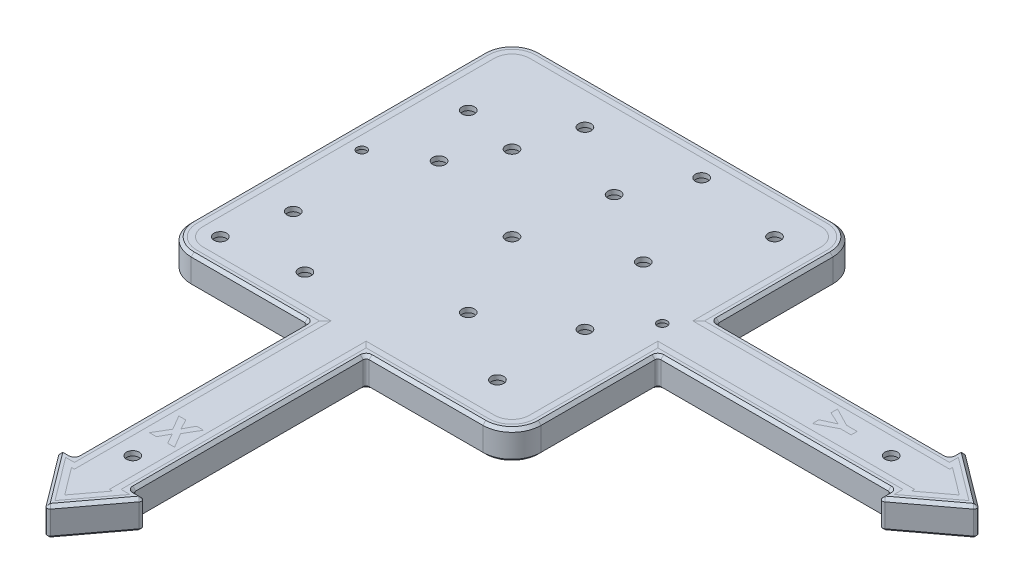
from build123d import *

# Parameters (mm, degrees)
BOSS_EXTRUDE1_DEPTH   = 10
SKETCH2_R             = 2.15
CUT_EXTRUDE1_DEPTH    = 199.242276016
SKETCH3_R             = 1.65
CUT_EXTRUDE2_DEPTH    = 199.242276016
SKETCH4_R             = 5
CUT_EXTRUDE3_DEPTH    = 8.4
SKETCH5_R             = 3
CUT_EXTRUDE4_DEPTH    = 9
FILLET1_R             = 10
BOSS_EXTRUDE2_DEPTH   = 10
CUT_EXTRUDE5_DEPTH    = 1
BOSS_EXTRUDE3_DEPTH   = 1
CUT_EXTRUDE6_DEPTH    = 1
BOSS_EXTRUDE4_DEPTH   = 1
CUT_EXTRUDE7_DEPTH    = 1
BOSS_EXTRUDE5_DEPTH   = 1
BOSS_EXTRUDE5_2_DEPTH = 1
FILLET2_R             = 1
CHAMFER1_SIZE         = 1
CUT_EXTRUDE8_DEPTH    = 1
BOSS_EXTRUDE6_DEPTH   = 1
CUT_EXTRUDE9_DEPTH    = 1
BOSS_EXTRUDE7_DEPTH   = 1


with BuildPart() as part:
    # Sketch1 → Boss-Extrude1 (new body)
    with BuildSketch(Plane(origin=(0, 0, 0), x_dir=(1, 0, 0), z_dir=(0, 1, 0))):
        Polygon((-10, -60), (-10, -140), (10, -140), (10, -60), (60, -60), (60, -10), (140, -10), (140, 10), (60, 10), (60, 60), (-60, 60), (-60, -60), align=None)
    extrude(amount=BOSS_EXTRUDE1_DEPTH)

    # Sketch2 → Cut-Extrude1 (cut, through all)
    with BuildSketch(Plane(origin=(0, 10, 0), x_dir=(1, 0, 0), z_dir=(0, 1, 0))):
        with Locations(Location((0, 0, 0), (0, 0, 270))):
            Circle(SKETCH2_R)
        with Locations(Location((130, 0, 0), (0, 0, 270))):
            Circle(SKETCH2_R)
        with Locations(Location((0, -130, 0), (0, 0, 270))):
            Circle(SKETCH2_R)
        with Locations(Location((40, -45, 0), (0, 0, 270))):
            Circle(SKETCH2_R)
        with Locations(Location((-45, -30, 0), (0, 0, 270))):
            Circle(SKETCH2_R)
        with Locations(Location((-26, 26, 0), (0, 0, 270))):
            Circle(SKETCH2_R)
        with Locations(Location((45, 45, 0), (0, 0, 270))):
            Circle(SKETCH2_R)
        with Locations(Location((15, 50, 0), (0, 0, 270))):
            Circle(SKETCH2_R)
        with Locations(Location((40, -15, 0), (0, 0, 270))):
            Circle(SKETCH2_R)
        with Locations(Location((-25, -46, 0), (0, 0, 270))):
            Circle(SKETCH2_R)
        with Locations(Location((-45, 30, 0), (0, 0, 270))):
            Circle(SKETCH2_R)
        with Locations(Location((-20, 45, 0), (0, 0, 270))):
            Circle(SKETCH2_R)
        with Locations(Location((15, -30, 0), (0, 0, 270))):
            Circle(SKETCH2_R)
        with Locations(Location((30, 15, 0), (0, 0, 270))):
            Circle(SKETCH2_R)
        with Locations(Location((-35, 10, 0), (0, 0, 270))):
            Circle(SKETCH2_R)
        with Locations(Location((5, 30, 0), (0, 0, 270))):
            Circle(SKETCH2_R)
        with Locations(Location((-50, -50, 0), (0, 0, 270))):
            Circle(SKETCH2_R)
    extrude(amount=-CUT_EXTRUDE1_DEPTH, mode=Mode.SUBTRACT)

    # Sketch3 → Cut-Extrude2 (cut, through all)
    with BuildSketch(Plane(origin=(0, 10, 0), x_dir=(1, 0, 0), z_dir=(0, 1, 0))):
        with Locations(Location((51.5, 0, 0), (0, 0, 270))):
            Circle(SKETCH3_R)
        with Locations(Location((-51.5, 0, 0), (0, 0, 270))):
            Circle(SKETCH3_R)
    extrude(amount=-CUT_EXTRUDE2_DEPTH, mode=Mode.SUBTRACT)

    # Sketch4 → Cut-Extrude3 (cut)
    with BuildSketch(Plane.XZ):
        with Locations(Location((-45, 30, 0), (0, 0, 270))):
            Circle(SKETCH4_R)
        with Locations(Location((40, 45, 0), (0, 0, 270))):
            Circle(SKETCH4_R)
        with Locations(Location((0, 130, 0), (0, 0, 270))):
            Circle(SKETCH4_R)
        with Locations(Location((130, 0, 0), (0, 0, 270))):
            Circle(SKETCH4_R)
        with Locations(Location((0, 0, 0), (0, 0, 270))):
            Circle(SKETCH4_R)
        with Locations(Location((-26, -26, 0), (0, 0, 270))):
            Circle(SKETCH4_R)
        with Locations(Location((45, -45, 0), (0, 0, 270))):
            Circle(SKETCH4_R)
        with Locations(Location((40, 15, 0), (0, 0, 270))):
            Circle(SKETCH4_R)
        with Locations(Location((-25, 46, 0), (0, 0, 270))):
            Circle(SKETCH4_R)
        with Locations(Location((-45, -30, 0), (0, 0, 270))):
            Circle(SKETCH4_R)
        with Locations(Location((15, -50, 0), (0, 0, 270))):
            Circle(SKETCH4_R)
        with Locations(Location((15, 30, 0), (0, 0, 270))):
            Circle(SKETCH4_R)
        with Locations(Location((30, -15, 0), (0, 0, 270))):
            Circle(SKETCH4_R)
        with Locations(Location((-20, -45, 0), (0, 0, 270))):
            Circle(SKETCH4_R)
        with Locations(Location((-35, -10, 0), (0, 0, 270))):
            Circle(SKETCH4_R)
        with Locations(Location((5, -30, 0), (0, 0, 270))):
            Circle(SKETCH4_R)
        with Locations(Location((-50, 50, 0), (0, 0, 270))):
            Circle(SKETCH4_R)
    extrude(amount=-CUT_EXTRUDE3_DEPTH, mode=Mode.SUBTRACT)

    # Sketch5 → Cut-Extrude4 (cut)
    with BuildSketch(Plane.XZ):
        with Locations(Location((-51.5, 0, 0), (0, 0, 270))):
            Circle(SKETCH5_R)
        with Locations(Location((51.5, 0, 0), (0, 0, 270))):
            Circle(SKETCH5_R)
    extrude(amount=-CUT_EXTRUDE4_DEPTH, mode=Mode.SUBTRACT)

    # Fillet1
    fillet1_edges = [part.edges().sort_by_distance(p)[0] for p in [
        (60, 5, 60),
        (-60, 5, 60),
        (-60, 5, -60),
        (60, 5, -60),
    ]]
    fillet(fillet1_edges, radius=FILLET1_R)

    # Sketch6 → Boss-Extrude2 (add)
    with BuildSketch(Plane(origin=(0, 10, 0), x_dir=(1, 0, 0), z_dir=(0, 1, 0))):
        Polygon((0, -140), (15, -140), (0, -160), (-15, -140), align=None)
        Polygon((140, 0), (140, -15), (160, 0), (140, 15), align=None)
    extrude(amount=-BOSS_EXTRUDE2_DEPTH)

    # Sketch7 → Cut-Extrude5 (cut)
    with BuildSketch(Plane(origin=(0, 10, 0), x_dir=(1, 0, 0), z_dir=(0, 1, 0))):
        Polygon((6, -144), (6, -56), (8, -58), (8, -142), (11, -142), (0, -156.666666667), (-11, -142), (-8, -142), (-8, -58), (-6, -56), (-6, -144), (-7, -144), (0, -153.333333333), (7, -144), align=None)
    extrude(amount=-CUT_EXTRUDE5_DEPTH, mode=Mode.SUBTRACT)

    # Sketch7<4> → Cut-Extrude6 (cut)
    with BuildSketch(Plane(origin=(0, 10, 0), x_dir=(1, 0, 0), z_dir=(0, 1, 0))):
        Polygon((144, 6), (56, 6), (58, 8), (142, 8), (142, 11), (156.666666667, 0), (142, -11), (142, -8), (58, -8), (56, -6), (144, -6), (144, -7), (153.333333333, 0), (144, 7), align=None)
    extrude(amount=-CUT_EXTRUDE6_DEPTH, mode=Mode.SUBTRACT)

    # Sketch7<6> → Cut-Extrude7 (cut)
    with BuildSketch(Plane(origin=(0, 10, 0), x_dir=(1, 0, 0), z_dir=(0, 1, 0))):
        with BuildLine():
            ThreePointArc((56, 50), (54.242640687, 54.242640687), (50, 56))
            Line((50, 56), (-50, 56))
            ThreePointArc((-50, 56), (-54.242640687, 54.242640687), (-56, 50))
            Line((-56, 50), (-56, -50))
            ThreePointArc((-56, -50), (-54.242640687, -54.242640687), (-50, -56))
            Line((-50, -56), (-6, -56))
            Line((-6, -56), (-8, -58))
            Line((-8, -58), (-50, -58))
            ThreePointArc((-50, -58), (-55.656854249, -55.656854249), (-58, -50))
            Line((-58, -50), (-58, 50))
            ThreePointArc((-58, 50), (-55.656854249, 55.656854249), (-50, 58))
            Line((-50, 58), (50, 58))
            ThreePointArc((50, 58), (55.656854249, 55.656854249), (58, 50))
            Line((58, 50), (58, 8))
            Line((58, 8), (56, 6))
            Line((56, 6), (56, 50))
        make_face()
        with BuildLine():
            ThreePointArc((50, -56), (54.242640687, -54.242640687), (56, -50))
            Line((56, -50), (56, -6))
            Line((56, -6), (58, -8))
            Line((58, -8), (58, -50))
            ThreePointArc((58, -50), (55.656854249, -55.656854249), (50, -58))
            Line((50, -58), (8, -58))
            Line((8, -58), (6, -56))
            Line((6, -56), (50, -56))
        make_face()
    extrude(amount=-CUT_EXTRUDE7_DEPTH, mode=Mode.SUBTRACT)

    # Fillet2
    fillet2_edges = [part.edges().sort_by_distance(p)[0] for p in [
        (60, 5, -10),
        (140, 5, -10),
        (140, 5, 10),
        (60, 5, 10),
        (10, 5, 60),
        (10, 5, 140),
        (-10, 5, 140),
        (-10, 5, 60),
        (0, 5, 160),
        (15, 5, 140),
        (-15, 5, 140),
        (140, 5, 15),
        (160, 5, 0),
        (140, 5, -15),
    ]]
    fillet(fillet2_edges, radius=FILLET2_R)

    # Chamfer1
    chamfer1_edges = [part.edges().sort_by_distance(p)[0] for p in [
        (-60, 0, 0),
        (-60, 10, 0),
        (60, 0, 30.5),
        (-30.5, 0, 60),
        (0, 0, -60),
        (57.071067812, 0, 57.071067812),
        (-57.071067812, 0, 57.071067812),
        (57.071067812, 0, -57.071067812),
        (-57.071067812, 0, -57.071067812),
        (0, 10, -60),
        (-30.5, 10, 60),
        (60, 10, 30.5),
        (57.071067812, 10, 57.071067812),
        (-57.071067812, 10, 57.071067812),
        (57.071067812, 10, -57.071067812),
        (-57.071067812, 10, -57.071067812),
        (60, 0, -30.5),
        (60, 10, -30.5),
        (100, 0, -10),
        (100, 10, -10),
        (-10, 0, 100),
        (-10, 10, 100),
        (30.5, 0, 60),
        (30.5, 10, 60),
        (10, 0, 100),
        (10, 10, 100),
        (100, 0, 10),
        (100, 10, 10),
        (140, 10, 12),
        (140, 0, 12),
        (-12, 10, 140),
        (-7.3, 10, 150.266666667),
        (7.3, 10, 150.266666667),
        (12, 10, 140),
        (150.266666667, 10, 7.3),
        (150.266666667, 10, -7.3),
        (140, 10, -12),
        (13.894427191, 10, 140.552786405),
        (0, 10, 159.333333333),
        (-13.894427191, 10, 140.552786405),
        (159.333333333, 10, 0),
        (140.552786405, 10, -13.894427191),
        (140.552786405, 10, 13.894427191),
        (150.266666667, 0, 7.3),
        (140, 0, -12),
        (150.266666667, 0, -7.3),
        (12, 0, 140),
        (7.3, 0, 150.266666667),
        (-7.3, 0, 150.266666667),
        (-12, 0, 140),
        (13.894427191, 0, 140.552786405),
        (0, 0, 159.333333333),
        (-13.894427191, 0, 140.552786405),
        (159.333333333, 0, 0),
        (140.552786405, 0, -13.894427191),
        (140.552786405, 0, 13.894427191),
        (60.292893219, 0, -10.292893219),
        (60.292893219, 10, -10.292893219),
        (-10.292893219, 0, 60.292893219),
        (-10.292893219, 10, 60.292893219),
        (10.292893219, 0, 60.292893219),
        (10.292893219, 10, 60.292893219),
        (60.292893219, 0, 10.292893219),
        (60.292893219, 10, 10.292893219),
        (139.707106781, 0, 10.292893219),
        (139.707106781, 10, 10.292893219),
        (139.707106781, 0, -10.292893219),
        (139.707106781, 10, -10.292893219),
        (-10.292893219, 0, 139.707106781),
        (-10.292893219, 10, 139.707106781),
        (10.292893219, 0, 139.707106781),
        (10.292893219, 10, 139.707106781),
    ]]
    chamfer(chamfer1_edges, length=CHAMFER1_SIZE - 0.0001)  # a hair under: the kernel refuses the full size

    # Sketch8 → Cut-Extrude8 (cut)
    with BuildSketch(Plane(origin=(0, 10, 0), x_dir=(1, 0, 0), z_dir=(0, 1, 0))):
        Polygon((0.328010799, -113.757586344), (2.198952357, -110.30994024), (4.560965344, -110.30994024), (1.657150409, -115.269355824), (4.636046513, -120.30994024), (2.245624435, -120.30994024), (0.328010799, -116.807505175), (-1.589602838, -120.30994024), (-3.980024916, -120.30994024), (-1.001128812, -115.269355824), (-3.904943747, -110.30994024), (-1.540901539, -110.30994024), align=None)
    extrude(amount=-CUT_EXTRUDE8_DEPTH, mode=Mode.SUBTRACT)

    # Sketch9 → Cut-Extrude9 (cut)
    with BuildSketch(Plane(origin=(0, 10, 0), x_dir=(1, 0, 0), z_dir=(0, 1, 0))):
        Polygon((111.451808288, 0.328327922), (106.946938158, 2.404220779), (106.946938158, 4.650568182), (113.320720626, 1.375405844), (116.946938158, 1.375405844), (116.946938158, -0.712662338), (113.320720626, -0.712662338), (106.946938158, -3.985795455), (106.946938158, -1.73336039), align=None)
    extrude(amount=-CUT_EXTRUDE9_DEPTH, mode=Mode.SUBTRACT)


with BuildPart() as body_2:
    # Sketch7<3> → Boss-Extrude3 (new body)
    with BuildSketch(Plane(origin=(0, 10, 0), x_dir=(1, 0, 0), z_dir=(0, 1, 0))):
        Polygon((6, -144), (6, -56), (8, -58), (8, -142), (11, -142), (0, -156.666666667), (-11, -142), (-8, -142), (-8, -58), (-6, -56), (-6, -144), (-7, -144), (0, -153.333333333), (7, -144), align=None)
    extrude(amount=-BOSS_EXTRUDE3_DEPTH)


with BuildPart() as body_3:
    # Sketch7<5> → Boss-Extrude4 (new body)
    with BuildSketch(Plane(origin=(0, 10, 0), x_dir=(1, 0, 0), z_dir=(0, 1, 0))):
        Polygon((144, 6), (56, 6), (58, 8), (142, 8), (142, 11), (156.666666667, 0), (142, -11), (142, -8), (58, -8), (56, -6), (144, -6), (144, -7), (153.333333333, 0), (144, 7), align=None)
    extrude(amount=-BOSS_EXTRUDE4_DEPTH)


with BuildPart() as body_4:
    # Sketch7<7> → Boss-Extrude5 (new body)
    with BuildSketch(Plane(origin=(0, 10, 0), x_dir=(1, 0, 0), z_dir=(0, 1, 0))):
        with BuildLine():
            ThreePointArc((56, 50), (54.242640687, 54.242640687), (50, 56))
            Line((50, 56), (-50, 56))
            ThreePointArc((-50, 56), (-54.242640687, 54.242640687), (-56, 50))
            Line((-56, 50), (-56, -50))
            ThreePointArc((-56, -50), (-54.242640687, -54.242640687), (-50, -56))
            Line((-50, -56), (-6, -56))
            Line((-6, -56), (-8, -58))
            Line((-8, -58), (-50, -58))
            ThreePointArc((-50, -58), (-55.656854249, -55.656854249), (-58, -50))
            Line((-58, -50), (-58, 50))
            ThreePointArc((-58, 50), (-55.656854249, 55.656854249), (-50, 58))
            Line((-50, 58), (50, 58))
            ThreePointArc((50, 58), (55.656854249, 55.656854249), (58, 50))
            Line((58, 50), (58, 8))
            Line((58, 8), (56, 6))
            Line((56, 6), (56, 50))
        make_face()
    extrude(amount=-BOSS_EXTRUDE5_DEPTH)


with BuildPart() as body_5:
    # Sketch7<7> → Boss-Extrude5 2 (new body)
    with BuildSketch(Plane(origin=(0, 10, 0), x_dir=(1, 0, 0), z_dir=(0, 1, 0))):
        with BuildLine():
            ThreePointArc((50, -56), (54.242640687, -54.242640687), (56, -50))
            Line((56, -50), (56, -6))
            Line((56, -6), (58, -8))
            Line((58, -8), (58, -50))
            ThreePointArc((58, -50), (55.656854249, -55.656854249), (50, -58))
            Line((50, -58), (8, -58))
            Line((8, -58), (6, -56))
            Line((6, -56), (50, -56))
        make_face()
    extrude(amount=-BOSS_EXTRUDE5_2_DEPTH)


with BuildPart() as body_6:
    # Sketch8<2> → Boss-Extrude6 (new body)
    with BuildSketch(Plane(origin=(0, 10, 0), x_dir=(1, 0, 0), z_dir=(0, 1, 0))):
        Polygon((0.328010799, -113.757586344), (2.198952357, -110.30994024), (4.560965344, -110.30994024), (1.657150409, -115.269355824), (4.636046513, -120.30994024), (2.245624435, -120.30994024), (0.328010799, -116.807505175), (-1.589602838, -120.30994024), (-3.980024916, -120.30994024), (-1.001128812, -115.269355824), (-3.904943747, -110.30994024), (-1.540901539, -110.30994024), align=None)
    extrude(amount=-BOSS_EXTRUDE6_DEPTH)


with BuildPart() as body_7:
    # Sketch9<2> → Boss-Extrude7 (new body)
    with BuildSketch(Plane(origin=(0, 10, 0), x_dir=(1, 0, 0), z_dir=(0, 1, 0))):
        Polygon((111.451808288, 0.328327922), (106.946938158, 2.404220779), (106.946938158, 4.650568182), (113.320720626, 1.375405844), (116.946938158, 1.375405844), (116.946938158, -0.712662338), (113.320720626, -0.712662338), (106.946938158, -3.985795455), (106.946938158, -1.73336039), align=None)
    extrude(amount=-BOSS_EXTRUDE7_DEPTH)


solid = Compound([part.part, body_2.part, body_3.part, body_4.part, body_5.part, body_6.part, body_7.part])
